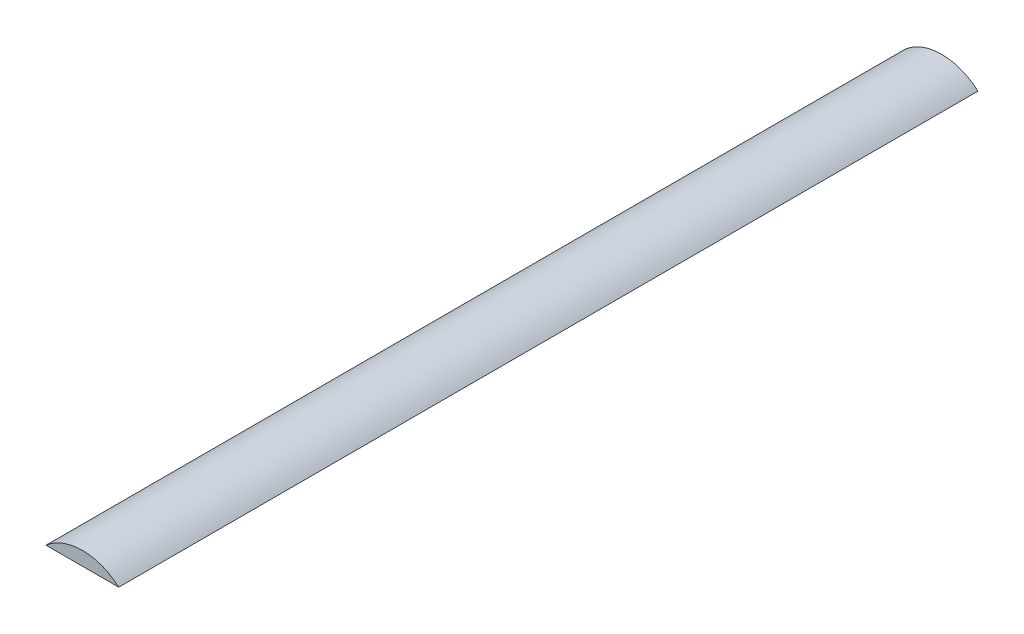
from build123d import *

# Parameters (mm, degrees)
EXTRUDE_1_DEPTH = 250


with BuildPart() as part:
    # 草图1 → 凸台-拉伸1 (new body)
    with BuildSketch(Plane.XY):
        with BuildLine():
            Line((5, 1), (-5.583005244, 1))
            ThreePointArc((-5.583005244, 1), (5, 5), (15.583005244, 1))
            Line((15.583005244, 1), (5, 1))
        make_face()
    extrude(amount=EXTRUDE_1_DEPTH)


solid = part.part
